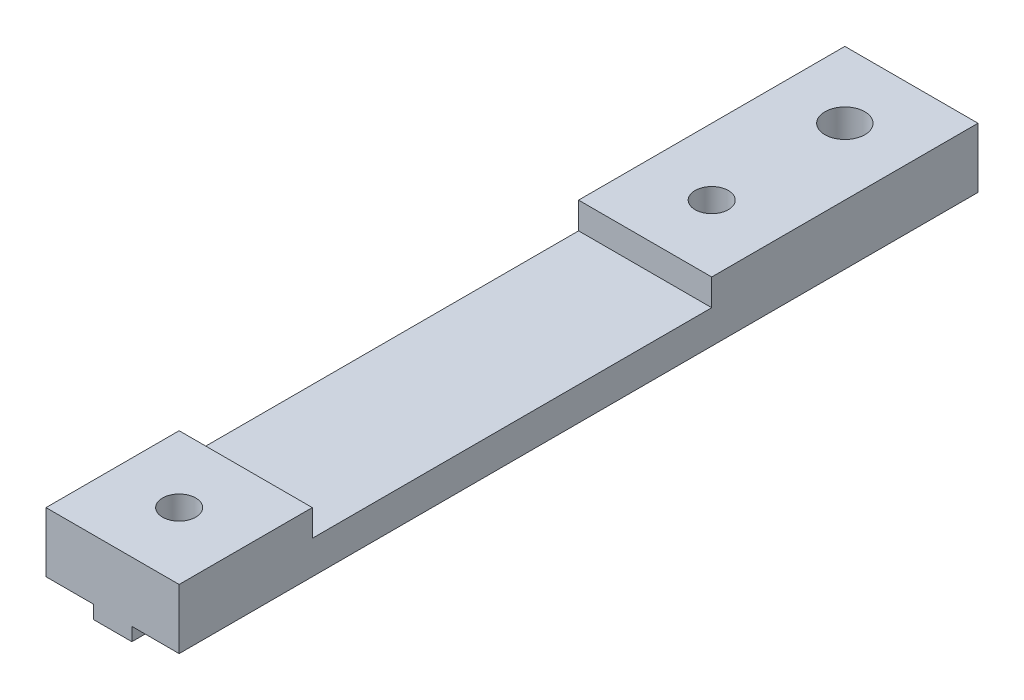
from build123d import *

# Parameters (mm, degrees)
MAIN_DEPTH            = 60
SKETCH2_R             = 1.25
SKETCH2_R_2           = 1.5
I2CBOARDFIXHOLE_DEPTH = 61.458663564
SKETCH3_W             = 10
SKETCH3_H             = 30
PINS_DEPTH            = 2


with BuildPart() as part:
    # Sketch1 → Main (new body)
    with BuildSketch(Plane.XY):
        Polygon((-5, 0), (5, 0), (5, -4.5), (1.45, -4.5), (1.45, -5.5), (-1.45, -5.5), (-1.45, -4.5), (-5, -4.5), align=None)
    extrude(amount=MAIN_DEPTH)

    # Sketch2 → I2CBoardFixHole (cut, through all)
    with BuildSketch(Plane(origin=(0, 0, 0), x_dir=(1, 0, 0), z_dir=(0, 1, 0))):
        with Locations((0, -55)):
            Circle(SKETCH2_R)
        with Locations((0, -15)):
            Circle(SKETCH2_R)
        with Locations((0, -5)):
            Circle(SKETCH2_R_2)
    extrude(amount=-I2CBOARDFIXHOLE_DEPTH, mode=Mode.SUBTRACT)

    # Sketch3 → Pins (cut)
    with BuildSketch(Plane(origin=(0, 0, 0), x_dir=(1, 0, 0), z_dir=(0, 1, 0))):
        with Locations((0, -35)):
            Rectangle(SKETCH3_W, SKETCH3_H)
    extrude(amount=-PINS_DEPTH, mode=Mode.SUBTRACT)


solid = part.part
